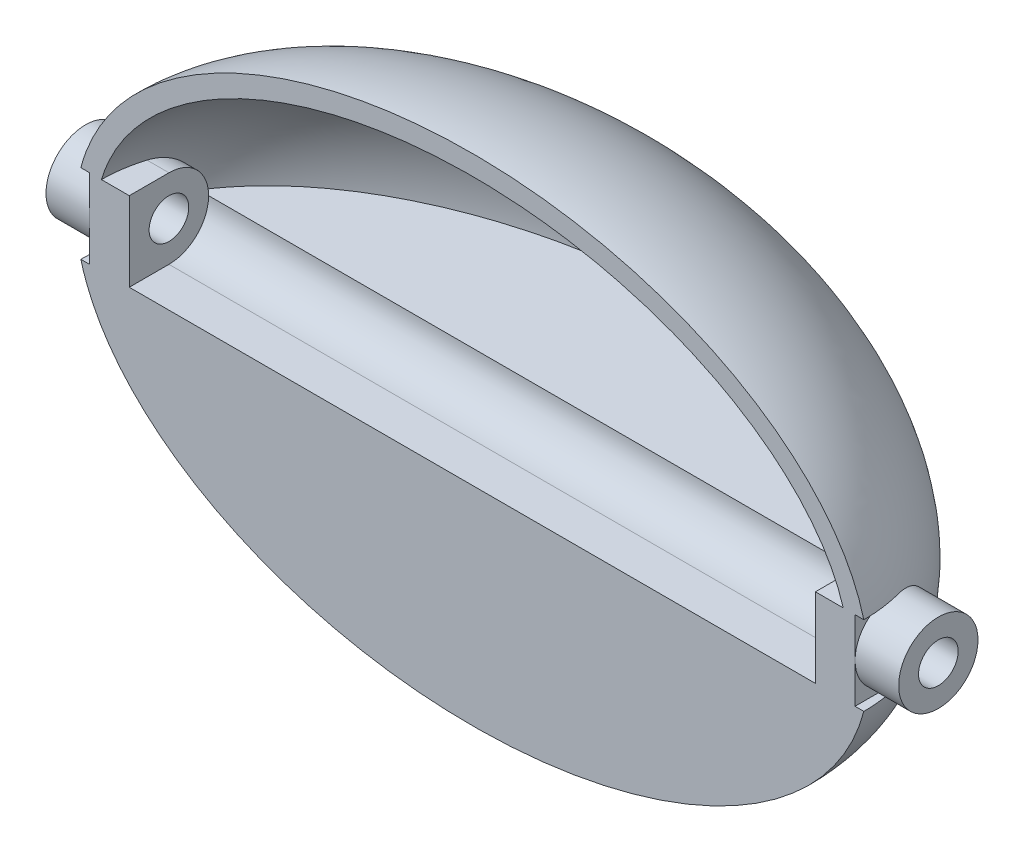
from build123d import *
from build123d.topology import SkipClean

# Parameters (mm, degrees)
SKETCH_3_W          = 40
SKETCH_3_H          = 40
CUT_EXTRUDE_1_DEPTH = 70
CUT_REVOLVE_1_ANGLE = 90
CUT_EXTRUDE_2_DEPTH = 452.082032598
EXTRUDE_1_DEPTH     = 42
SKETCH_7_R          = 10
CUT_EXTRUDE_3_DEPTH = 440
CUT_EXTRUDE_4_DEPTH = 22
SKETCH_9_W          = 60
SKETCH_9_H          = 30
CUT_EXTRUDE_5_DEPTH = 30


with BuildPart() as part:
    # 草图1 → 旋转3 (revolve)
    with SkipClean():  # the faces are left unmerged after this step: merging them gives an invalid solid
        with BuildSketch(Plane(origin=(0, 0, 0), x_dir=(1, 0, 0), z_dir=(0, 1, 0))):
            with BuildLine():
                add(Edge.make_bspline(
                    [(200, 0), (200, 125), (0, 125), (-200, 125), (-200, 0)],
                    knots=[0, 0, 0, 1.570796327, 1.570796327, 3.141592654, 3.141592654, 3.141592654], degree=2, weights=[1, 0.707106781, 1, 0.707106781, 1]))
                Line((-200, 0), (200, 0))
            make_face()
            with BuildLine():
                Line((200, 0), (-200, 0))
                add(Edge.make_bspline(
                    [(-200, 0), (-200, -125), (0, -125), (200, -125), (200, 0)],
                    knots=[3.141592654, 3.141592654, 3.141592654, 4.71238898, 4.71238898, 6.283185307, 6.283185307, 6.283185307], degree=2, weights=[1, 0.707106781, 1, 0.707106781, 1]))
            make_face()
        revolve(axis=Axis((-376.776806715, 0, 0), (1, 0, 0)))
    add(part.part.scale(1), mode=Mode.REPLACE)  # the faces are merged on a copy

    # Surface Cut 1
    split(bisect_by=Plane.XY, keep=Keep.BOTTOM)

    # 草图3 → 切除-拉伸1 (cut)
    with BuildSketch(Plane(origin=(0, -125.246294878, -45.585923288), x_dir=(1, 0, 0), z_dir=(0, 0.9396926207859081, 0.34202014332566943))):
        with Locations((0, 43.622733675)):
            Rectangle(SKETCH_3_W, SKETCH_3_H)
    extrude(amount=CUT_EXTRUDE_1_DEPTH, mode=Mode.SUBTRACT)

    # 草图4 → 切除-旋转1 (revolve, cut)
    with BuildSketch(Plane.XY):
        with BuildLine():
            Line((-189.264857791, 10), (189.264857791, 10))
            add(Edge.make_bspline(
                [(189.264857791, 10), (189.01661408, 11.685645813), (188.399842232, 15.02459428), (186.660672029, 21.717695752), (183.544014825, 30.028723701), (178.280438028, 39.871100011), (169.238112825, 52.698753606), (154.190025082, 67.938441209), (130.617285564, 84.133702491), (102.331625356, 97.503941795), (70.346299789, 107.469826997), (35.819572857, 113.615740598), (0, 115.692129701), (-35.819572857, 113.615740598), (-70.346299789, 107.469826997), (-102.331625356, 97.503941795), (-130.617285564, 84.133702491), (-154.190025082, 67.938441209), (-169.238112825, 52.698753606), (-178.280438028, 39.871100011), (-183.544014825, 30.028723701), (-186.660672029, 21.717695752), (-188.399842232, 15.02459428), (-189.01661408, 11.685645813), (-189.264857791, 10)],
                knots=[0.091784635, 0.091784635, 0.091784635, 0.091784635, 0.13800375, 0.184222866, 0.276661096, 0.369099327, 0.461537558, 0.646414019, 0.831290481, 1.016166942, 1.201043404, 1.385919865, 1.570796327, 1.755672788, 1.94054925, 2.125425711, 2.310302173, 2.495178634, 2.680055096, 2.772493326, 2.864931557, 2.957369788, 3.003588903, 3.049808019, 3.049808019, 3.049808019, 3.049808019], degree=3))
        make_face()
    revolve(axis=Axis((-200, 0, 0), (-1, 0, 0)), revolution_arc=CUT_REVOLVE_1_ANGLE, mode=Mode.SUBTRACT)

    # 草图5 → 切除-拉伸2 (cut, through all)
    with BuildSketch(Plane(origin=(215, 0, 0), x_dir=(0, 0, -1), z_dir=(1, 0, 0))):
        with BuildLine():
            ThreePointArc((20, 20), (40, 0), (20, -20))
            Line((20, -20), (0, -20))
            Line((0, -20), (0, 20))
            Line((0, 20), (20, 20))
        make_face()
    extrude(amount=-CUT_EXTRUDE_2_DEPTH, mode=Mode.SUBTRACT)

    # 草图6 → 凸台-拉伸1 (add)
    with BuildSketch(Plane(origin=(215, 0, 0), x_dir=(0, 0, -1), z_dir=(1, 0, 0))):
        with BuildLine():
            Line((20, -20), (0, -20))
            Line((0, -20), (0, 20))
            Line((0, 20), (20, 20))
            ThreePointArc((20, 20), (40, 0), (20, -20))
        make_face()
    extrude_1 = extrude(amount=-EXTRUDE_1_DEPTH)

    # 镜向1: 凸台-拉伸1 across plane
    add(extrude_1.mirror(Plane(origin=(0, 0, 0), x_dir=(0, 0, 1), z_dir=(1, 0, 0))))

    # 草图7 → 切除-拉伸3 (cut)
    with BuildSketch(Plane(origin=(215, 0, 0), x_dir=(0, 0, -1), z_dir=(1, 0, 0))):
        with Locations(Location((20, 0, 0), (0, 0, 180))):
            Circle(SKETCH_7_R)
    extrude(amount=-CUT_EXTRUDE_3_DEPTH, mode=Mode.SUBTRACT)

    # 草图8 → 切除-拉伸4 (cut)
    with BuildSketch(Plane(origin=(215, 0, 0), x_dir=(0, 0, -1), z_dir=(1, 0, 0))):
        with BuildLine():
            ThreePointArc((0, 4.7e-08), (5.857864393, 14.14213564), (20, 20))
            Line((20, 20), (0, 20))
            Line((0, 20), (0, 4.7e-08))
        make_face()
        with BuildLine():
            ThreePointArc((20, -20), (5.85786436, -14.142135607), (0, 4.7e-08))
            Line((0, 4.7e-08), (0, -20))
            Line((0, -20), (20, -20))
        make_face()
    cut_extrude_4 = extrude(amount=-CUT_EXTRUDE_4_DEPTH, mode=Mode.SUBTRACT)

    # 镜向2: 切除-拉伸4 across plane
    add(cut_extrude_4.mirror(Plane(origin=(0, 0, 0), x_dir=(0, 0, 1), z_dir=(1, 0, 0))), mode=Mode.SUBTRACT)

    # 草图9 → 切除-拉伸5 (cut)
    with BuildSketch(Plane(origin=(0, -126.642161547, -22.330429976), x_dir=(1, 0, 0), z_dir=(0, 0.984807753012208, 0.17364817766693072))):
        with Locations((0, 13.014685424)):
            Rectangle(SKETCH_9_W, SKETCH_9_H)
    extrude(amount=CUT_EXTRUDE_5_DEPTH, mode=Mode.SUBTRACT)


solid = part.part
